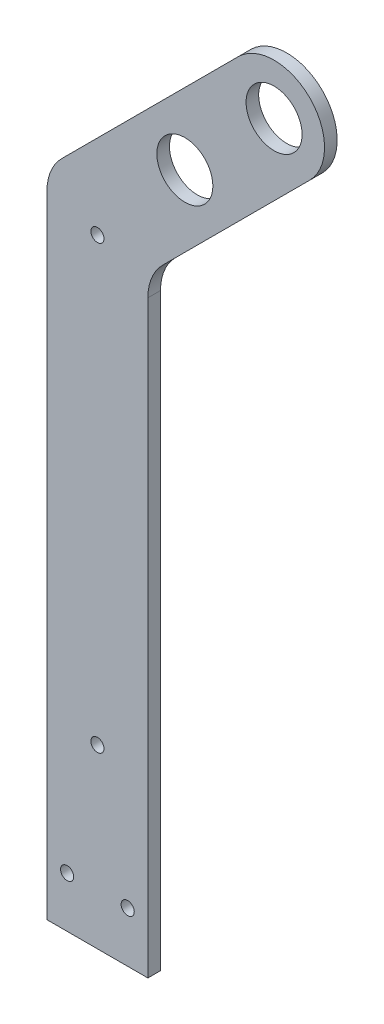
from build123d import *

# Parameters (mm, degrees)
SKETCH_1_R                = 20
SKETCH_1_R_2              = 11.1
EXTRUDE_1_DEPTH           = 60
EXTRUDE_2_DEPTH           = 30
SKETCH_4_R                = 11
EXTRUDE_3_DEPTH           = 5
SKETCH_8_R                = 11.1
CUT_EXTRUDE_1_DEPTH       = 100
FILLET_4_R                = 20
EXTRUDE_START             = -30
SKETCH_18_R               = 35
EXTRUDE_4_DEPTH           = 5
EXTRUDE_START_2           = -25
SKETCH_19_R               = 35
EXTRUDE_5_DEPTH           = 5
FILLET_5_R                = 10
CUT_EXTRUDE_9_DEPTH       = 388.169213652
CUT_EXTRUDE_9_DEPTH_BACK  = 388.169213652
SKETCH_21_R               = 2.6
CUT_EXTRUDE_10_DEPTH      = 407.881000043
CUT_EXTRUDE_10_DEPTH_BACK = 407.881000043
SKETCH_22_W               = 45
SKETCH_22_H               = 451.378457943
SKETCH_22_W_2             = 20
SKETCH_22_H_2             = 431.087956996


with BuildPart() as part:
    # 草图1 → 凸台-拉伸1 (new body)
    with BuildSketch(Plane.XY):
        Circle(SKETCH_1_R)
        Circle(SKETCH_1_R_2, mode=Mode.SUBTRACT)
    extrude(amount=EXTRUDE_1_DEPTH)

    # 草图2 → 凸台-拉伸2 (add, symmetric)
    with BuildSketch(Plane.XY.offset(30)):
        with BuildLine():
            Line((-14.142135624, 14.142135624), (-90, -61.715728753))
            Line((-90, -61.715728753), (-90, -320))
            Line((-90, -320), (-50, -320))
            Line((-50, -320), (-50, -78.284271247))
            Line((-50, -78.284271247), (14.142135624, -14.142135624))
            ThreePointArc((14.142135624, -14.142135624), (-14.142135624, -14.142135624), (-14.142135624, 14.142135624))
        make_face()
    extrude(amount=EXTRUDE_2_DEPTH, both=True)

    # 草图4 → 凸台-拉伸3 (add)
    with BuildSketch(Plane.XY.offset(60)):
        with BuildLine():
            Line((-90, -290), (-50, -290))
            Line((-50, -290), (-50, -350))
            ThreePointArc((-50, -350), (-70, -370), (-90, -350))
            Line((-90, -350), (-90, -290))
        make_face()
        with Locations((-70, -350)):
            Circle(SKETCH_4_R, mode=Mode.SUBTRACT)
    extrude_3 = extrude(amount=EXTRUDE_3_DEPTH)

    # 镜向1: 凸台-拉伸3 across plane
    add(extrude_3.mirror(Plane.XY.offset(30)))

    # 草图8 → 切除-拉伸1 (cut)
    with BuildSketch(Plane.XY.offset(60)):
        with Locations((-35.355339059, -35.355339059)):
            Circle(SKETCH_8_R)
    extrude(amount=-CUT_EXTRUDE_1_DEPTH, mode=Mode.SUBTRACT)

    # 圆角4
    fillet_4_edges = [part.edges().sort_by_distance(p)[0] for p in [
        (-50, -78.284271247, 30),
        (-90, -61.715728753, 30),
    ]]
    fillet(fillet_4_edges, radius=FILLET_4_R)

    # 草图18 → 凸台-拉伸4 (add)
    with BuildSketch(Plane.XY.offset(60).offset(EXTRUDE_START)):
        with BuildLine():
            ThreePointArc((15.487252676, -12.654841151), (14.833346688, -13.415357842), (14.142135624, -14.142135624))
            Line((14.142135624, -14.142135624), (-44.142135624, -72.426406871))
            ThreePointArc((-44.142135624, -72.426406871), (-48.47759065, -78.914873848), (-50, -86.568542495))
            Line((-50, -86.568542495), (-50, -128.513280962))
            Line((-50, -128.513280962), (20.291868618, -128.513280962))
            ThreePointArc((20.291868618, -128.513280962), (62.790327113, -100.116718851), (52.818780552, -49.986369028))
            Line((52.818780552, -49.986369028), (15.487252676, -12.654841151))
        make_face()
        with Locations((20.291868618, -82.513280962)):
            Circle(SKETCH_18_R, mode=Mode.SUBTRACT)
    extrude(amount=EXTRUDE_4_DEPTH)

    # 草图19 → 凸台-拉伸5 (add)
    with BuildSketch(Plane(origin=(0, 0, 0), x_dir=(-1, 0, 0), z_dir=(0, 0, -1)).offset(EXTRUDE_START_2)):
        with BuildLine():
            Line((50, -134.571348531), (50, -226.571348531))
            Line((50, -226.571348531), (-0.680255104, -226.571348531))
            ThreePointArc((-0.680255104, -226.571348531), (-46.680255104, -180.571348531), (-0.680255104, -134.571348531))
            Line((-0.680255104, -134.571348531), (50, -134.571348531))
        make_face()
        with Locations((-0.680255104, -180.571348531)):
            Circle(SKETCH_19_R, mode=Mode.SUBTRACT)
    extrude(amount=-EXTRUDE_5_DEPTH)

    # 圆角5
    # the kernel refuses this fillet: 10 mm, written as the material it adds along each edge
    with BuildSketch(Plane(origin=(-50, -226.571348531, 25), x_dir=(0, -1, 0), z_dir=(0, 0, 1)), Plane(origin=(-50, -128.513280962, 30), x_dir=(0, -1, 0), z_dir=(0, 0, 1))) as fillet_5_piece_1:
        with BuildLine():
            CenterArc((FILLET_5_R, FILLET_5_R), FILLET_5_R, 180, 90)
            Line((0, FILLET_5_R), (0, 0))
            Line((0, 0), (FILLET_5_R, 0))
        make_face()
    extrude(amount=5)

    # 草图21 → 切除-拉伸9 (cut, two sides: drawn at the far end of the back side and taken through both)
    with BuildSketch(Plane.XY.offset(65).offset(-CUT_EXTRUDE_9_DEPTH_BACK)):
        with Locations((-70, -75)):
            Circle(SKETCH_21_R)
        with Locations((-70, -250)):
            Circle(SKETCH_21_R)
        with Locations((-58, -300)):
            Circle(SKETCH_21_R)
        with Locations((-82, -300)):
            Circle(SKETCH_21_R)
    extrude(amount=CUT_EXTRUDE_9_DEPTH + CUT_EXTRUDE_9_DEPTH_BACK, mode=Mode.SUBTRACT)

    # 草图22 → 切除-拉伸10 (cut, two sides: drawn at the far end of the back side and taken through both)
    with BuildSketch(Plane.ZY.offset(90).offset(-CUT_EXTRUDE_10_DEPTH_BACK)):
        with Locations((17.5, -160.771309387)):
            Rectangle(SKETCH_22_W, SKETCH_22_H)
        with Locations((55, -154.456021502)):
            Rectangle(SKETCH_22_W_2, SKETCH_22_H_2)
    extrude(amount=CUT_EXTRUDE_10_DEPTH + CUT_EXTRUDE_10_DEPTH_BACK, mode=Mode.SUBTRACT)


solid = part.part
